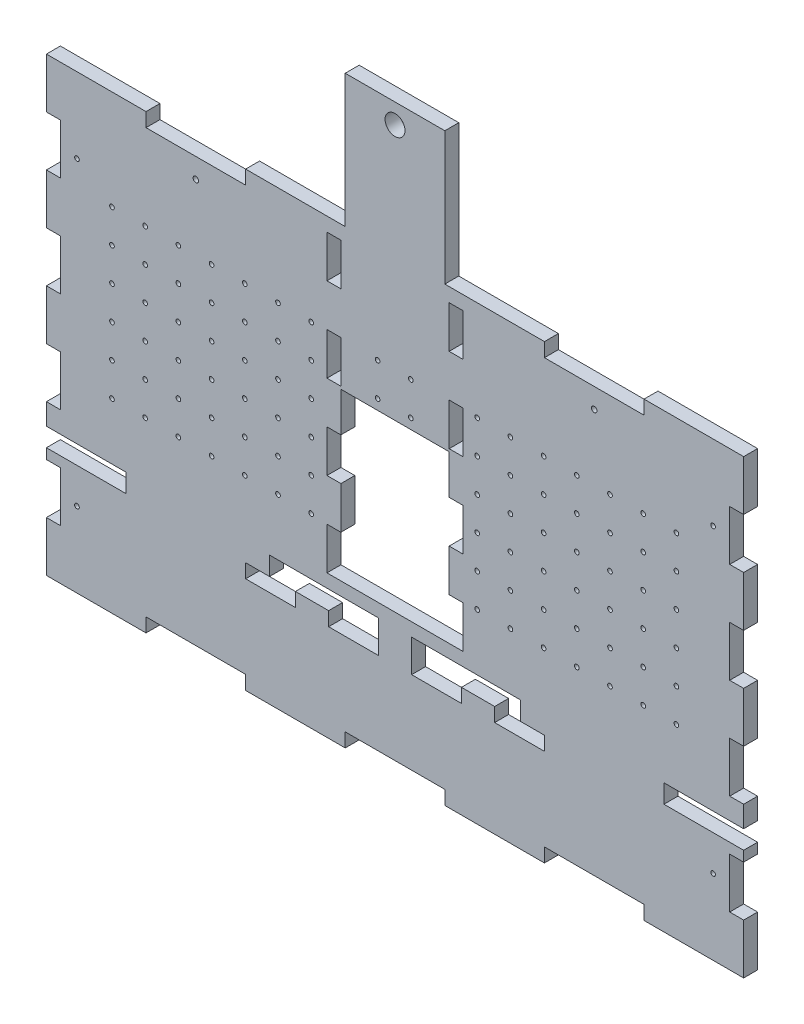
from build123d import *

# Parameters (mm, degrees)
SKETCH1_W           = 266.7
SKETCH1_H           = 172.72
BOSS_EXTRUDE1_DEPTH = 5.334
SKETCH2_W           = 38.1
SKETCH2_H           = 5.334
CUT_EXTRUDE1_DEPTH  = 165.701204222
SKETCH5_W           = 41.656
SKETCH5_H           = 7.112
CUT_EXTRUDE3_DEPTH  = 165.701204222
SKETCH9_W           = 5.334
SKETCH9_H           = 19.191111111
CUT_EXTRUDE7_DEPTH  = 165.701204222
SKETCH10_W          = 38.1
SKETCH10_H          = 5.334
BOSS_EXTRUDE2_DEPTH = 50.8
SKETCH11_W          = 6.604
SKETCH11_H          = 40.64
CUT_EXTRUDE8_DEPTH  = 197.710659379
SKETCH12_R          = 3.81
CUT_EXTRUDE9_DEPTH  = 197.710659379
SKETCH14_R          = 0.889
CUT_EXTRUDE11_DEPTH = 197.710659379
SKETCH15_W          = 6.604
SKETCH15_H          = 10.16
CUT_EXTRUDE12_DEPTH = 197.710659379
SKETCH16_W          = 41.402
SKETCH16_H          = 63.5
CUT_EXTRUDE13_DEPTH = 197.710659379
SKETCH17_W          = 5.334
SKETCH17_H          = 16.124650759
SKETCH17_H_2        = 16.124650758
CUT_EXTRUDE14_DEPTH = 197.710659379
SKETCH18_W          = 38.1
SKETCH18_H          = 56.134
BOSS_EXTRUDE3_DEPTH = 5.334
SKETCH19_W          = 34.756768033
SKETCH19_H          = 54.94363668
CUT_EXTRUDE15_DEPTH = 197.710659379
SKETCH20_R          = 3.81
CUT_EXTRUDE16_DEPTH = 197.710659379
SKETCH21_R          = 0.889
CUT_EXTRUDE17_DEPTH = 197.710659379
SKETCH22_W          = 19.05
SKETCH22_H          = 5.334
CUT_EXTRUDE18_DEPTH = 197.710659379
SKETCH23_R          = 1.04775
CUT_EXTRUDE19_DEPTH = 197.710659379


with BuildPart() as part:
    # Sketch1 → Boss-Extrude1 (new body)
    with BuildSketch(Plane.XY):
        with Locations((5.474099752, 2.104142138)):
            Rectangle(SKETCH1_W, SKETCH1_H)
    extrude(amount=BOSS_EXTRUDE1_DEPTH)

    # Sketch2 → Cut-Extrude1 (cut, through all)
    with BuildSketch(Plane.XY.offset(5.334)):
        with Locations((-70.725900248, -81.588857862)):
            Rectangle(SKETCH2_W, SKETCH2_H)
        with Locations((5.474099752, -81.588857862)):
            Rectangle(SKETCH2_W, SKETCH2_H)
        with Locations((81.674099752, -81.588857862)):
            Rectangle(SKETCH2_W, SKETCH2_H)
        with Locations((81.674099752, 85.797142138)):
            Rectangle(SKETCH2_W, SKETCH2_H)
        with Locations((5.474099752, 85.797142138)):
            Rectangle(SKETCH2_W, SKETCH2_H)
        with Locations((-70.725900248, 85.797142138)):
            Rectangle(SKETCH2_W, SKETCH2_H)
    extrude(amount=-CUT_EXTRUDE1_DEPTH, mode=Mode.SUBTRACT)

    # Sketch5 → Cut-Extrude3 (cut, through all)
    with BuildSketch(Plane.XY.offset(5.334)):
        with Locations((32.652099752, -38.378413173)):
            Rectangle(SKETCH5_W, SKETCH5_H)
        with Locations((-21.703900248, -38.378413173)):
            Rectangle(SKETCH5_W, SKETCH5_H)
        with Locations((-118.223900248, -38.378413173)):
            Rectangle(SKETCH5_W, SKETCH5_H)
        with Locations((129.172099752, -38.378413173)):
            Rectangle(SKETCH5_W, SKETCH5_H)
    extrude(amount=-CUT_EXTRUDE3_DEPTH, mode=Mode.SUBTRACT)

    # Sketch9 → Cut-Extrude7 (cut, through all)
    with BuildSketch(Plane.XY.offset(5.334)):
        with Locations((-125.208900248, -55.469191196)):
            Rectangle(SKETCH9_W, SKETCH9_H)
        with Locations((-125.208900248, -17.086968973)):
            Rectangle(SKETCH9_W, SKETCH9_H)
        with Locations((-125.208900248, 21.295253249)):
            Rectangle(SKETCH9_W, SKETCH9_H)
        with Locations((-125.208900248, 59.677475472)):
            Rectangle(SKETCH9_W, SKETCH9_H)
        with Locations((136.157099752, 59.677475472)):
            Rectangle(SKETCH9_W, SKETCH9_H)
        with Locations((136.157099752, 21.295253249)):
            Rectangle(SKETCH9_W, SKETCH9_H)
        with Locations((136.157099752, -17.086968973)):
            Rectangle(SKETCH9_W, SKETCH9_H)
        with Locations((136.157099752, -55.469191196)):
            Rectangle(SKETCH9_W, SKETCH9_H)
    extrude(amount=-CUT_EXTRUDE7_DEPTH, mode=Mode.SUBTRACT)

    # Sketch10 → Boss-Extrude2 (add)
    with BuildSketch(Plane(origin=(0, 88.464142138, 0), x_dir=(1, 0, 0), z_dir=(0, 1, 0))):
        with Locations((43.574099752, -2.667)):
            Rectangle(SKETCH10_W, SKETCH10_H)
    extrude(amount=BOSS_EXTRUDE2_DEPTH)

    # Sketch11 → Cut-Extrude8 (cut, through all)
    with BuildSketch(Plane(origin=(0, 0, 0), x_dir=(-1, 0, 0), z_dir=(0, 0, -1))):
        with Locations((-27.826099752, 108.784142138)):
            Rectangle(SKETCH11_W, SKETCH11_H)
    extrude(amount=-CUT_EXTRUDE8_DEPTH, mode=Mode.SUBTRACT)

    # Sketch12 → Cut-Extrude9 (cut, through all)
    with BuildSketch(Plane.XY.offset(5.334)):
        with Locations((43.574099752, 130.476471297)):
            Circle(SKETCH12_R)
    extrude(amount=-CUT_EXTRUDE9_DEPTH, mode=Mode.SUBTRACT)

    # Sketch14 → Cut-Extrude11 (cut, through all)
    with BuildSketch(Plane.XY.offset(5.334)):
        with Locations((-102.797588144, 50.364142138)):
            Circle(SKETCH14_R)
        with Locations((-90.097588144, 50.364142138)):
            Circle(SKETCH14_R)
        with Locations((-77.397588144, 50.364142138)):
            Circle(SKETCH14_R)
        with Locations((-64.697588144, 50.364142138)):
            Circle(SKETCH14_R)
        with Locations((-51.997588144, 50.364142138)):
            Circle(SKETCH14_R)
        with Locations((-39.297588144, 50.364142138)):
            Circle(SKETCH14_R)
        with Locations((-26.597588144, 50.364142138)):
            Circle(SKETCH14_R)
        with Locations((-1.197588144, 50.364142138)):
            Circle(SKETCH14_R)
        with Locations((11.502411856, 50.364142138)):
            Circle(SKETCH14_R)
        with Locations((36.902411856, 50.364142138)):
            Circle(SKETCH14_R)
        with Locations((49.602411856, 50.364142138)):
            Circle(SKETCH14_R)
        with Locations((62.302411856, 50.364142138)):
            Circle(SKETCH14_R)
        with Locations((75.002411856, 50.364142138)):
            Circle(SKETCH14_R)
        with Locations((87.702411856, 50.364142138)):
            Circle(SKETCH14_R)
        with Locations((100.402411856, 50.364142138)):
            Circle(SKETCH14_R)
        with Locations((113.102411856, 50.364142138)):
            Circle(SKETCH14_R)
        with Locations((-102.797588144, 37.664142138)):
            Circle(SKETCH14_R)
        with Locations((-90.097588144, 37.664142138)):
            Circle(SKETCH14_R)
        with Locations((-77.397588144, 37.664142138)):
            Circle(SKETCH14_R)
        with Locations((-64.697588144, 37.664142138)):
            Circle(SKETCH14_R)
        with Locations((-51.997588144, 37.664142138)):
            Circle(SKETCH14_R)
        with Locations((-39.297588144, 37.664142138)):
            Circle(SKETCH14_R)
        with Locations((-26.597588144, 37.664142138)):
            Circle(SKETCH14_R)
        with Locations((-1.197588144, 37.664142138)):
            Circle(SKETCH14_R)
        with Locations((11.502411856, 37.664142138)):
            Circle(SKETCH14_R)
        with Locations((36.902411856, 37.664142138)):
            Circle(SKETCH14_R)
        with Locations((49.602411856, 37.664142138)):
            Circle(SKETCH14_R)
        with Locations((62.302411856, 37.664142138)):
            Circle(SKETCH14_R)
        with Locations((75.002411856, 37.664142138)):
            Circle(SKETCH14_R)
        with Locations((87.702411856, 37.664142138)):
            Circle(SKETCH14_R)
        with Locations((100.402411856, 37.664142138)):
            Circle(SKETCH14_R)
        with Locations((113.102411856, 37.664142138)):
            Circle(SKETCH14_R)
        with Locations((-102.797588144, 24.964142138)):
            Circle(SKETCH14_R)
        with Locations((-90.097588144, 24.964142138)):
            Circle(SKETCH14_R)
        with Locations((-77.397588144, 24.964142138)):
            Circle(SKETCH14_R)
        with Locations((-64.697588144, 24.964142138)):
            Circle(SKETCH14_R)
        with Locations((-51.997588144, 24.964142138)):
            Circle(SKETCH14_R)
        with Locations((-39.297588144, 24.964142138)):
            Circle(SKETCH14_R)
        with Locations((-26.597588144, 24.964142138)):
            Circle(SKETCH14_R)
        with Locations((-1.197588144, 24.964142138)):
            Circle(SKETCH14_R)
        with Locations((11.502411856, 24.964142138)):
            Circle(SKETCH14_R)
        with Locations((36.902411856, 24.964142138)):
            Circle(SKETCH14_R)
        with Locations((49.602411856, 24.964142138)):
            Circle(SKETCH14_R)
        with Locations((62.302411856, 24.964142138)):
            Circle(SKETCH14_R)
        with Locations((75.002411856, 24.964142138)):
            Circle(SKETCH14_R)
        with Locations((87.702411856, 24.964142138)):
            Circle(SKETCH14_R)
        with Locations((100.402411856, 24.964142138)):
            Circle(SKETCH14_R)
        with Locations((113.102411856, 24.964142138)):
            Circle(SKETCH14_R)
        with Locations((-102.797588144, 12.264142138)):
            Circle(SKETCH14_R)
        with Locations((-90.097588144, 12.264142138)):
            Circle(SKETCH14_R)
        with Locations((-77.397588144, 12.264142138)):
            Circle(SKETCH14_R)
        with Locations((-64.697588144, 12.264142138)):
            Circle(SKETCH14_R)
        with Locations((-51.997588144, 12.264142138)):
            Circle(SKETCH14_R)
        with Locations((-39.297588144, 12.264142138)):
            Circle(SKETCH14_R)
        with Locations((-26.597588144, 12.264142138)):
            Circle(SKETCH14_R)
        with Locations((36.902411856, 12.264142138)):
            Circle(SKETCH14_R)
        with Locations((49.602411856, 12.264142138)):
            Circle(SKETCH14_R)
        with Locations((62.302411856, 12.264142138)):
            Circle(SKETCH14_R)
        with Locations((75.002411856, 12.264142138)):
            Circle(SKETCH14_R)
        with Locations((87.702411856, 12.264142138)):
            Circle(SKETCH14_R)
        with Locations((100.402411856, 12.264142138)):
            Circle(SKETCH14_R)
        with Locations((113.102411856, 12.264142138)):
            Circle(SKETCH14_R)
        with Locations((-102.797588144, -0.435857862)):
            Circle(SKETCH14_R)
        with Locations((-90.097588144, -0.435857862)):
            Circle(SKETCH14_R)
        with Locations((-77.397588144, -0.435857862)):
            Circle(SKETCH14_R)
        with Locations((-64.697588144, -0.435857862)):
            Circle(SKETCH14_R)
        with Locations((-51.997588144, -0.435857862)):
            Circle(SKETCH14_R)
        with Locations((-39.297588144, -0.435857862)):
            Circle(SKETCH14_R)
        with Locations((-26.597588144, -0.435857862)):
            Circle(SKETCH14_R)
        with Locations((-13.897588144, -0.435857862)):
            Circle(SKETCH14_R)
        with Locations((-1.197588144, -0.435857862)):
            Circle(SKETCH14_R)
        with Locations((11.502411856, -0.435857862)):
            Circle(SKETCH14_R)
        with Locations((24.202411856, -0.435857862)):
            Circle(SKETCH14_R)
        with Locations((36.902411856, -0.435857862)):
            Circle(SKETCH14_R)
        with Locations((49.602411856, -0.435857862)):
            Circle(SKETCH14_R)
        with Locations((62.302411856, -0.435857862)):
            Circle(SKETCH14_R)
        with Locations((75.002411856, -0.435857862)):
            Circle(SKETCH14_R)
        with Locations((87.702411856, -0.435857862)):
            Circle(SKETCH14_R)
        with Locations((100.402411856, -0.435857862)):
            Circle(SKETCH14_R)
        with Locations((113.102411856, -0.435857862)):
            Circle(SKETCH14_R)
        with Locations((-102.797588144, -13.135857862)):
            Circle(SKETCH14_R)
        with Locations((-90.097588144, -13.135857862)):
            Circle(SKETCH14_R)
        with Locations((-77.397588144, -13.135857862)):
            Circle(SKETCH14_R)
        with Locations((-64.697588144, -13.135857862)):
            Circle(SKETCH14_R)
        with Locations((-51.997588144, -13.135857862)):
            Circle(SKETCH14_R)
        with Locations((-39.297588144, -13.135857862)):
            Circle(SKETCH14_R)
        with Locations((-26.597588144, -13.135857862)):
            Circle(SKETCH14_R)
        with Locations((-13.897588144, -13.135857862)):
            Circle(SKETCH14_R)
        with Locations((-1.197588144, -13.135857862)):
            Circle(SKETCH14_R)
        with Locations((11.502411856, -13.135857862)):
            Circle(SKETCH14_R)
        with Locations((24.202411856, -13.135857862)):
            Circle(SKETCH14_R)
        with Locations((36.902411856, -13.135857862)):
            Circle(SKETCH14_R)
        with Locations((49.602411856, -13.135857862)):
            Circle(SKETCH14_R)
        with Locations((62.302411856, -13.135857862)):
            Circle(SKETCH14_R)
        with Locations((75.002411856, -13.135857862)):
            Circle(SKETCH14_R)
        with Locations((87.702411856, -13.135857862)):
            Circle(SKETCH14_R)
        with Locations((100.402411856, -13.135857862)):
            Circle(SKETCH14_R)
        with Locations((113.102411856, -13.135857862)):
            Circle(SKETCH14_R)
    extrude(amount=-CUT_EXTRUDE11_DEPTH, mode=Mode.SUBTRACT)

    # Sketch15 → Cut-Extrude12 (cut, through all)
    with BuildSketch(Plane.XY.offset(5.334)):
        with Locations((27.826099752, 134.184142138)):
            Rectangle(SKETCH15_W, SKETCH15_H)
    extrude(amount=-CUT_EXTRUDE12_DEPTH, mode=Mode.SUBTRACT)

    # Sketch16 → Cut-Extrude13 (cut, through all)
    with BuildSketch(Plane.XY.offset(5.334)):
        with Locations((5.474099752, 2.007586827)):
            Rectangle(SKETCH16_W, SKETCH16_H)
    extrude(amount=-CUT_EXTRUDE13_DEPTH, mode=Mode.SUBTRACT)

    # Sketch17 → Cut-Extrude14 (cut, through all)
    with BuildSketch(Plane.XY.offset(5.334)):
        with Locations((-17.893900248, -21.680087794)):
            Rectangle(SKETCH17_W, SKETCH17_H)
        with Locations((-17.893900248, 10.569213724)):
            Rectangle(SKETCH17_W, SKETCH17_H)
        with Locations((-17.893900248, 42.818515241)):
            Rectangle(SKETCH17_W, SKETCH17_H_2)
        with Locations((-17.893900248, 75.067816759)):
            Rectangle(SKETCH17_W, SKETCH17_H)
        with Locations((28.842099752, 75.067816759)):
            Rectangle(SKETCH17_W, SKETCH17_H)
        with Locations((28.842099752, 42.818515241)):
            Rectangle(SKETCH17_W, SKETCH17_H_2)
        with Locations((28.842099752, 10.569213724)):
            Rectangle(SKETCH17_W, SKETCH17_H)
        with Locations((28.842099752, -21.680087794)):
            Rectangle(SKETCH17_W, SKETCH17_H)
    extrude(amount=-CUT_EXTRUDE14_DEPTH, mode=Mode.SUBTRACT)

    # Sketch18 → Boss-Extrude3 (add)
    with BuildSketch(Plane.XY.offset(5.334)):
        with Locations((5.474099752, 111.197142138)):
            Rectangle(SKETCH18_W, SKETCH18_H)
    extrude(amount=-BOSS_EXTRUDE3_DEPTH)

    # Sketch19 → Cut-Extrude15 (cut, through all)
    with BuildSketch(Plane.XY.offset(5.334)):
        with Locations((48.506483768, 115.935960478)):
            Rectangle(SKETCH19_W, SKETCH19_H)
    extrude(amount=-CUT_EXTRUDE15_DEPTH, mode=Mode.SUBTRACT)

    # Sketch20 → Cut-Extrude16 (cut, through all)
    with BuildSketch(Plane.XY.offset(5.334)):
        with Locations((5.474099752, 131.644142138)):
            Circle(SKETCH20_R)
    extrude(amount=-CUT_EXTRUDE16_DEPTH, mode=Mode.SUBTRACT)

    # Sketch21 → Cut-Extrude17 (cut, through all)
    with BuildSketch(Plane.XY.offset(5.334)):
        with Locations((127.140099752, 59.677475471)):
            Circle(SKETCH21_R)
        with Locations((-116.191900248, 59.677475471)):
            Circle(SKETCH21_R)
        with Locations((-116.191900248, -55.469191196)):
            Circle(SKETCH21_R)
        with Locations((127.140099752, -55.469191196)):
            Circle(SKETCH21_R)
    extrude(amount=-CUT_EXTRUDE17_DEPTH, mode=Mode.SUBTRACT)

    # Sketch22 → Cut-Extrude18 (cut, through all)
    with BuildSketch(Plane(origin=(0, 0, 0), x_dir=(-1, 0, 0), z_dir=(0, 0, -1))):
        with Locations((-21.349099752, -44.601413173)):
            Rectangle(SKETCH22_W, SKETCH22_H)
        with Locations((-53.099099752, -44.601413173)):
            Rectangle(SKETCH22_W, SKETCH22_H)
        with Locations((42.150900248, -44.601413173)):
            Rectangle(SKETCH22_W, SKETCH22_H)
        with Locations((10.400900248, -44.601413173)):
            Rectangle(SKETCH22_W, SKETCH22_H)
    extrude(amount=-CUT_EXTRUDE18_DEPTH, mode=Mode.SUBTRACT)

    # Sketch23 → Cut-Extrude19 (cut, through all)
    with BuildSketch(Plane(origin=(0, 0, 0), x_dir=(-1, 0, 0), z_dir=(0, 0, -1))):
        with Locations((-81.674099752, 75.510142138)):
            Circle(SKETCH23_R)
        with Locations((70.725900248, 75.510142138)):
            Circle(SKETCH23_R)
    extrude(amount=-CUT_EXTRUDE19_DEPTH, mode=Mode.SUBTRACT)


solid = part.part
